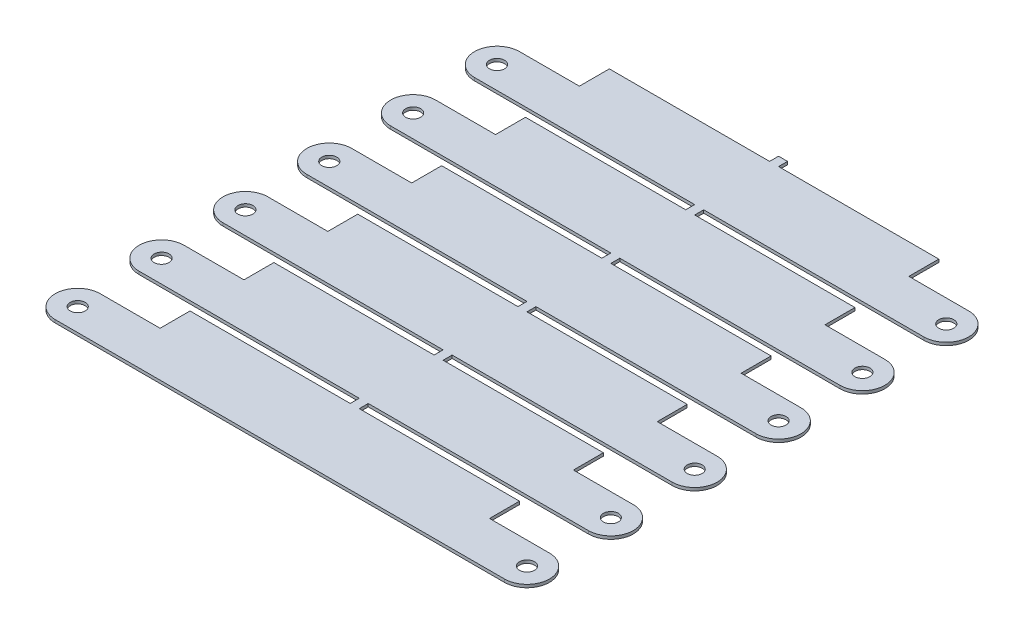
from build123d import *

# Parameters (mm, degrees)
SKETCH1_R           = 2.5
BOSS_EXTRUDE1_DEPTH = 1
LPATTERN1_COUNT     = 6
LPATTERN1_PITCH     = 28


with BuildPart() as part:
    # Sketch1 → Boss-Extrude1 (new body)
    with BuildSketch(Plane(origin=(0, 0, 0), x_dir=(1, 0, 0), z_dir=(0, 1, 0))):
        with BuildLine():
            Line((20, 7.5), (0, 7.5))
            ThreePointArc((0, 7.5), (-7.5, 0), (0, -7.5))
            Line((0, -7.5), (150, -7.5))
            ThreePointArc((150, -7.5), (157.5, 0), (150, 7.5))
            Line((150, 7.5), (130, 7.5))
            Line((130, 7.5), (130, 17.5))
            Line((130, 17.5), (76.5, 17.5))
            Line((76.5, 17.5), (76.5, 20.5))
            Line((76.5, 20.5), (73.5, 20.5))
            Line((73.5, 20.5), (73.5, 17.5))
            Line((73.5, 17.5), (20, 17.5))
            Line((20, 17.5), (20, 7.5))
        make_face()
        Circle(SKETCH1_R, mode=Mode.SUBTRACT)
        with Locations((150, 0)):
            Circle(SKETCH1_R, mode=Mode.SUBTRACT)
    boss_extrude1 = extrude(amount=BOSS_EXTRUDE1_DEPTH)

    # LPattern1: Boss-Extrude1 ×6
    with Locations(*[(0, 0, -i * LPATTERN1_PITCH) for i in range(1, LPATTERN1_COUNT)]):
        add(boss_extrude1)


solid = part.part
